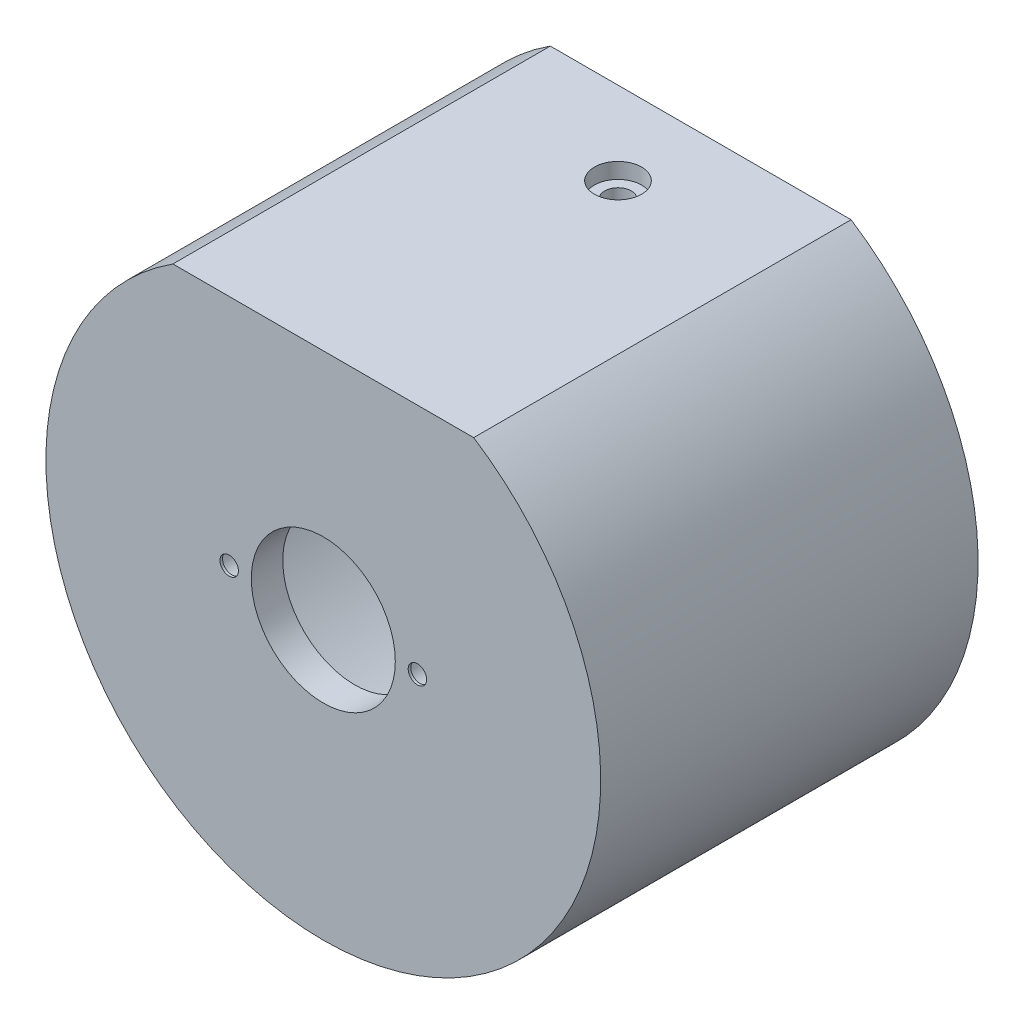
from build123d import *

# Parameters (mm, degrees)
BOSS_EXTRUDE1_DEPTH                             = 38.1
BOSS_EXTRUDE2_START                             = -3.175
BOSS_EXTRUDE2_DEPTH                             = 3.175
CBORE_FOR_2_PAN_HEAD_MACHINE_SCREW1_D           = 2.7051
CBORE_FOR_2_PAN_HEAD_MACHINE_SCREW1_DEPTH       = 2.667
CBORE_FOR_2_PAN_HEAD_MACHINE_SCREW1_CBORE_D     = 4.7625
CBORE_FOR_2_PAN_HEAD_MACHINE_SCREW1_CBORE_DEPTH = 1.5748
CBORE_START                                     = 26.4287
CBORE_FOR_2_PAN_HEAD_MACHINE_SCREW2_OUT_R       = 2.38125
CBORE_FOR_2_PAN_HEAD_MACHINE_SCREW2_DEPTH       = 1.574800075
CBORE_START_2                                   = 25.300372244
CBORE_FOR_2_PAN_HEAD_MACHINE_SCREW2_2_O_R       = 1.35255
CBORE_FOR_2_PAN_HEAD_MACHINE_SCREW2_2_DEPTH     = 1.128327756
CBORE_START_3                                   = -28.003500101
CBORE_FOR_2_PAN_HEAD_MACHINE_SCREW3_OUT_R       = 2.38125
CBORE_FOR_2_PAN_HEAD_MACHINE_SCREW3_DEPTH       = 1.574800101
CBORE_START_4                                   = -26.4287
CBORE_FOR_2_PAN_HEAD_MACHINE_SCREW3_2_O_R       = 1.35255
CBORE_FOR_2_PAN_HEAD_MACHINE_SCREW3_2_DEPTH     = 1.128327733
CUT_EXTRUDE1_REACH                              = 56.955
SKETCH20_R                                      = 7.27
HOLE1_AT_2_COUNT                                = 2
HOLE1_AT_2_PITCH                                = 19
F_0_CLEARANCE_HOLE1_D                           = 1.8542
CHAMFER1_SIZE                                   = 1.27


# Read off the part's stored shape, not the designer's step: CBORE for #2 Pan Head Machine Screw2, CBORE for #2 Pan Head Machine Screw3
with BuildPart() as part:
    # Sketch1 → Boss-Extrude1 (new body)
    with BuildSketch(Plane.XY):
        with BuildLine():
            Line((15.182514888, 23.53056), (-15.182514888, 23.53056))
            ThreePointArc((-15.182514888, 23.53056), (0, -28.0035), (15.182514888, 23.53056))
        make_face()
        with BuildLine():
            Line((14.375329435, 20.86356), (-14.375329435, 20.86356))
            ThreePointArc((-14.375329435, 20.86356), (0, -25.3365), (14.375329435, 20.86356))
        make_face(mode=Mode.SUBTRACT)
    extrude(amount=BOSS_EXTRUDE1_DEPTH)

    # Sketch10 → Boss-Extrude2 (add)
    with BuildSketch(Plane.XY.offset(38.1).offset(BOSS_EXTRUDE2_START)):
        with BuildLine():
            Line((15.182514888, 23.53056), (-15.182514888, 23.53056))
            ThreePointArc((-15.182514888, 23.53056), (0, -28.0035), (15.182514888, 23.53056))
        make_face()
    extrude(amount=BOSS_EXTRUDE2_DEPTH)

    # CBORE for #2 Pan Head Machine Screw1
    with Locations(Plane(origin=(-7.747359339, 23.53056, 10.2108), x_dir=(0, 0, -1), z_dir=(0, 1, 0))):
        with Locations((1.8613, -7.747359339)):
            CounterBoreHole(CBORE_FOR_2_PAN_HEAD_MACHINE_SCREW1_D / 2, CBORE_FOR_2_PAN_HEAD_MACHINE_SCREW1_CBORE_D / 2, CBORE_FOR_2_PAN_HEAD_MACHINE_SCREW1_CBORE_DEPTH, depth=CBORE_FOR_2_PAN_HEAD_MACHINE_SCREW1_DEPTH)

    # CBORE for #2 Pan Head Machine Screw2 out → CBORE for #2 Pan Head Machine Screw2 (cut)
    with BuildSketch(Plane(origin=(0, 0, 0), x_dir=(0.8660254037844416, 0.4999999999999948, 0), z_dir=(0.4999999999999948, -0.8660254037844417, 0)).offset(CBORE_START)):
        with Locations((0, 10.2108)):
            Circle(CBORE_FOR_2_PAN_HEAD_MACHINE_SCREW2_OUT_R)
    extrude(amount=CBORE_FOR_2_PAN_HEAD_MACHINE_SCREW2_DEPTH, mode=Mode.SUBTRACT)

    # CBORE for _2 Pan Head Machine Screw2 2 o → CBORE for _2 Pan Head Machine Screw2 2 (cut)
    with BuildSketch(Plane(origin=(0, 0, 0), x_dir=(0.8660254037844416, 0.4999999999999948, 0), z_dir=(0.4999999999999948, -0.8660254037844417, 0)).offset(CBORE_START_2)):
        with Locations((0, 10.2108)):
            Circle(CBORE_FOR_2_PAN_HEAD_MACHINE_SCREW2_2_O_R)
    extrude(amount=CBORE_FOR_2_PAN_HEAD_MACHINE_SCREW2_2_DEPTH, mode=Mode.SUBTRACT)

    # CBORE for #2 Pan Head Machine Screw3 out → CBORE for #2 Pan Head Machine Screw3 (cut)
    with BuildSketch(Plane.YZ.offset(CBORE_START_3)):
        with Locations((0, 10.2108)):
            Circle(CBORE_FOR_2_PAN_HEAD_MACHINE_SCREW3_OUT_R)
    extrude(amount=CBORE_FOR_2_PAN_HEAD_MACHINE_SCREW3_DEPTH, mode=Mode.SUBTRACT)

    # CBORE for _2 Pan Head Machine Screw3 2 o → CBORE for _2 Pan Head Machine Screw3 2 (cut)
    with BuildSketch(Plane.YZ.offset(CBORE_START_4)):
        with Locations((0, 10.2108)):
            Circle(CBORE_FOR_2_PAN_HEAD_MACHINE_SCREW3_2_O_R)
    extrude(amount=CBORE_FOR_2_PAN_HEAD_MACHINE_SCREW3_2_DEPTH, mode=Mode.SUBTRACT)

    # Sketch20 → Cut-Extrude1 (cut, up to next)
    with BuildSketch(Plane.XY.offset(38.1), mode=Mode.PRIVATE) as cut_extrude1_sk1:
        Circle(SKETCH20_R)
    cut_extrude1_tool1 = extrude(cut_extrude1_sk1.sketch, amount=-CUT_EXTRUDE1_REACH, mode=Mode.PRIVATE) & part.part
    add(cut_extrude1_tool1.solids().sort_by_distance((0, 0, 38.1))[0], mode=Mode.SUBTRACT)

    # Sketch22 → Hole1 (revolve, cut)
    with BuildSketch(Plane(origin=(9.5, 0, 34.925), x_dir=(0, 1, 0), z_dir=(1, 0, 0))):
        Polygon((0, 0), (0, 2.921), (1.4986, 2.921), (1.6383, 0), align=None)
    hole1 = revolve(axis=Axis((9.5, 0, 144.925), (0, 0, -1)), mode=Mode.SUBTRACT)

    # Hole1 at 2: Hole1 ×2
    with Locations(*[(-i * HOLE1_AT_2_PITCH, 0, 0) for i in range(1, HOLE1_AT_2_COUNT)]):
        add(hole1, mode=Mode.SUBTRACT)

    # #0 Clearance Hole1 (through all)
    with Locations(Plane(origin=(0, 0, 34.925), x_dir=(-1, 0, 0), z_dir=(0, 0, -1))):
        with Locations((-9.5, 0), (9.5, 0)):
            Hole(F_0_CLEARANCE_HOLE1_D / 2)

    # Chamfer1
    chamfer1_edges = [part.edges().sort_by_distance(p)[0] for p in [
        (0, -25.3365, 0),
        (0, 20.86356, 0),
    ]]
    chamfer(chamfer1_edges, length=CHAMFER1_SIZE)


solid = part.part
